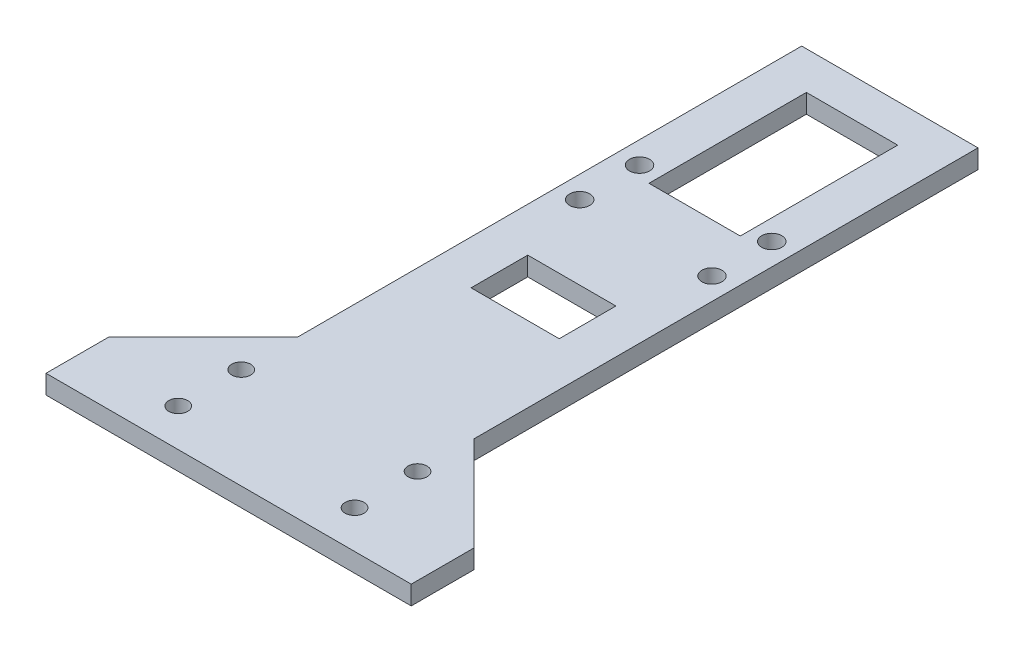
from build123d import *

# Parameters (mm, degrees)
SKETCH1_R           = 1.6
SKETCH1_R_2         = 1.5
SKETCH1_W           = 14
SKETCH1_H           = 9
SKETCH1_W_2         = 14.5
SKETCH1_H_2         = 25
BOSS_EXTRUDE1_DEPTH = 3


with BuildPart() as part:
    # Sketch1 → Boss-Extrude1 (new body)
    with BuildSketch(Plane(origin=(0, 0, 0), x_dir=(1, 0, 0), z_dir=(0, 1, 0))):
        Polygon((0, 0), (0, -80), (15, -95), (15, -105), (-43, -105), (-43, -95), (-28, -80), (-28, 0), align=None)
        with Locations((-24.5, -38.75)):
            Circle(SKETCH1_R, mode=Mode.SUBTRACT)
        with Locations((-3.5, -38.75)):
            Circle(SKETCH1_R, mode=Mode.SUBTRACT)
        with Locations((-3.5, -29.25)):
            Circle(SKETCH1_R, mode=Mode.SUBTRACT)
        with Locations((-24.5, -29.25)):
            Circle(SKETCH1_R, mode=Mode.SUBTRACT)
        with Locations((-28, -89)):
            Circle(SKETCH1_R_2, mode=Mode.SUBTRACT)
        with Locations((0, -89)):
            Circle(SKETCH1_R_2, mode=Mode.SUBTRACT)
        with Locations((-28, -99)):
            Circle(SKETCH1_R_2, mode=Mode.SUBTRACT)
        with Locations((0, -99)):
            Circle(SKETCH1_R_2, mode=Mode.SUBTRACT)
        with Locations((-14, -55)):
            Rectangle(SKETCH1_W, SKETCH1_H, mode=Mode.SUBTRACT)
        with Locations((-14, -18.5)):
            Rectangle(SKETCH1_W_2, SKETCH1_H_2, mode=Mode.SUBTRACT)
    extrude(amount=BOSS_EXTRUDE1_DEPTH)


solid = part.part
